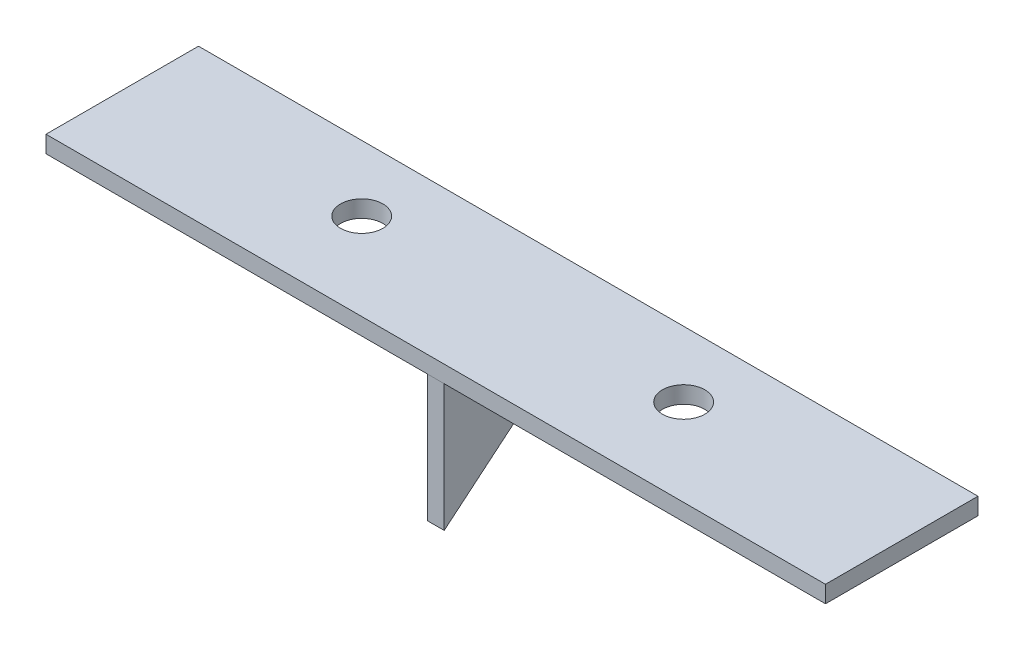
from build123d import *

# Parameters (mm, degrees)
SKETCH1_W           = 92
SKETCH1_H           = 18
BASE_FLANGE1_DEPTH  = 2
SKETCH11_R          = 2.5
CUT_EXTRUDE1_DEPTH  = 10
BOSS_EXTRUDE1_DEPTH = 1


# Sheet-metal steps are written as plain solids
with BuildPart() as part:
    # Sketch1 → Base-Flange1 (new body)
    with BuildSketch(Plane(origin=(0, 0, 0), x_dir=(1, 0, 0), z_dir=(0, 1, 0))):
        with Locations((0, 9)):
            Rectangle(SKETCH1_W, SKETCH1_H)
    extrude(amount=-BASE_FLANGE1_DEPTH)

    # Sketch11 → Cut-Extrude1 (cut)
    with BuildSketch(Plane(origin=(0, 0, 0), x_dir=(1, 0, 0), z_dir=(0, 1, 0))):
        with Locations(Location((-19, 10.26, 0), (0, 0, 270))):
            Circle(SKETCH11_R)
        with Locations(Location((19, 10.26, 0), (0, 0, 90))):
            Circle(SKETCH11_R)
    extrude(amount=-CUT_EXTRUDE1_DEPTH, mode=Mode.SUBTRACT)


with BuildPart() as body_2:
    # Sketch12 → Boss-Extrude1 (new, symmetric)
    with BuildSketch(Plane(origin=(0, 0, 0), x_dir=(0, 0, -1), z_dir=(1, 0, 0))):
        Polygon((18, -2), (0, -17), (0, -2), align=None)
    extrude(amount=BOSS_EXTRUDE1_DEPTH, both=True)


solid = Compound([part.part, body_2.part])
